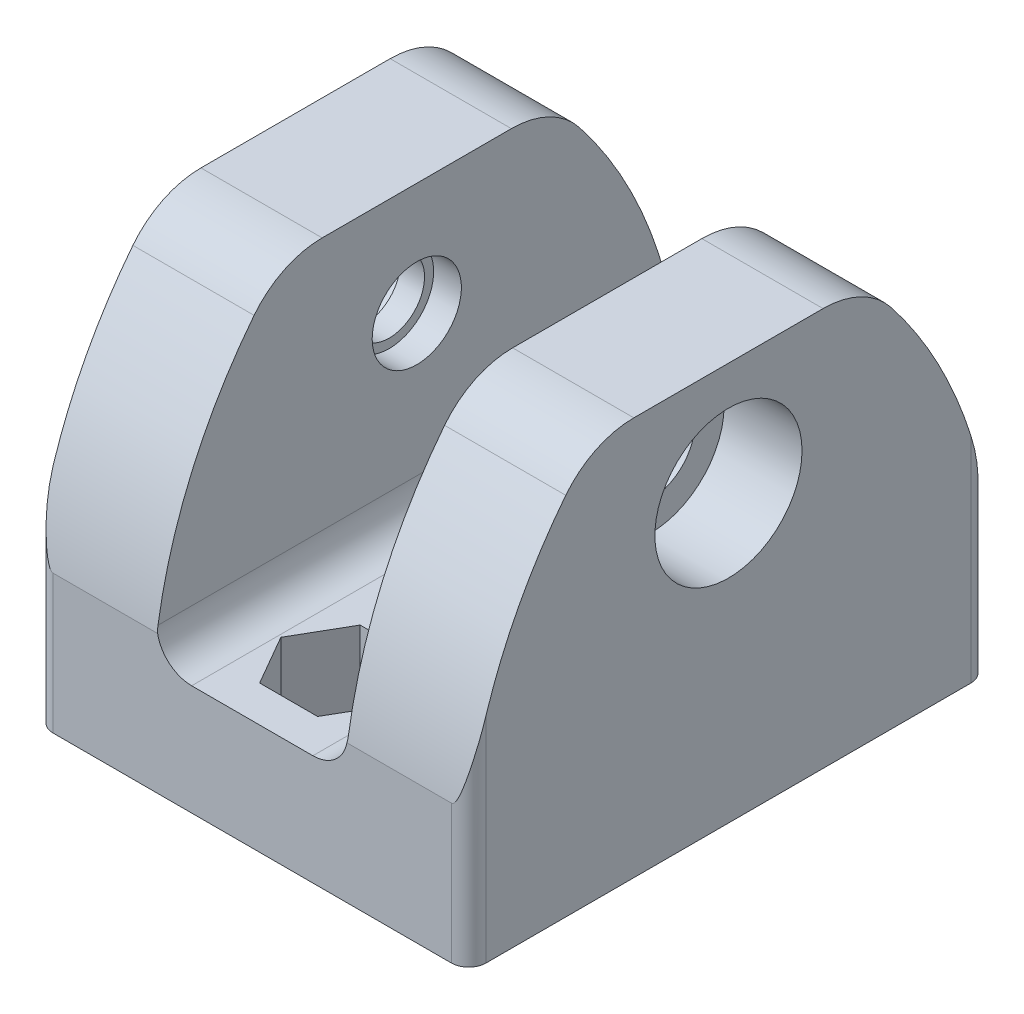
from build123d import *

# Parameters (mm, degrees)
CROQUIS1_W              = 25
CROQUIS1_H              = 30
CROQUIS1_R              = 1.55
SALIENTE_EXTRUIR1_DEPTH = 23
CORTAR_EXTRUIR1_REACH   = 47.321
CROQUIS2_W              = 9
CROQUIS2_H              = 16.632666969
CORTAR_EXTRUIR2_REACH   = 47.321
CROQUIS3_R              = 2.575
CORTAR_EXTRUIR3_DEPTH   = 2.5
CROQUIS5_R              = 4.25
CORTAR_EXTRUIR4_DEPTH   = 4.5
CORTAR_EXTRUIR5_DEPTH   = 4.5
CORTAR_EXTRUIR6_REACH   = 47.321
REDONDEO3_R             = 1
CROQUIS8_R              = 2.575
CROQUIS8_R_2            = 2.05
SALIENTE_EXTRUIR2_DEPTH = 2.9
CORTAR_EXTRUIR7_DEPTH   = 1.5
CORTAR_EXTRUIR8_START   = -16.632667
CROQUIS10_W             = 1
CROQUIS10_H             = 30
CORTAR_EXTRUIR8_DEPTH   = 16.632667
REDONDEO4_R             = 5
REDONDEO5_R             = 2


with BuildPart() as part:
    # Croquis1 → Saliente-Extruir1 (new body)
    with BuildSketch(Plane(origin=(0, 0, 0), x_dir=(1, 0, 0), z_dir=(0, 1, 0))):
        with Locations((12.5, 15)):
            Rectangle(CROQUIS1_W, CROQUIS1_H)
        with Locations(Location((12.5, 25, 0), (0, 0, 270))):
            Circle(CROQUIS1_R, mode=Mode.SUBTRACT)
        with Locations(Location((12.5, 5, 0), (0, 0, 270))):
            Circle(CROQUIS1_R, mode=Mode.SUBTRACT)
    extrude(amount=SALIENTE_EXTRUIR1_DEPTH)

    # Cortar-Extruir1: up to this face of the body (flat: up to its plane)
    cortar_extruir1_end = Plane(part.part.faces().sort_by_distance((12.5, 11.5, 0))[0])
    # Croquis2 → Cortar-Extruir1 (cut, up to the picked face)
    with BuildSketch(Plane(origin=(0, 0, -30), x_dir=(-1, 0, 0), z_dir=(0, 0, -1)), mode=Mode.PRIVATE) as cortar_extruir1_sk1:
        with Locations((-12.5, 14.683666516)):
            Rectangle(CROQUIS2_W, CROQUIS2_H)
    cortar_extruir1_tool1 = split(extrude(cortar_extruir1_sk1.sketch, amount=-CORTAR_EXTRUIR1_REACH, mode=Mode.PRIVATE), bisect_by=cortar_extruir1_end, keep=Keep.BOTH, mode=Mode.PRIVATE)
    add(cortar_extruir1_tool1.solids().sort_by(Axis((12.5, 14.683667, -30), (0, 0, 1)))[0], mode=Mode.SUBTRACT)

    # Cortar-Extruir2: up to this face of the body (flat: up to its plane)
    cortar_extruir2_end = Plane(part.part.faces().sort_by_distance((25, 11.5, -15))[0])
    # Croquis3 → Cortar-Extruir2 (cut, up to the picked face)
    with BuildSketch(Plane.ZY, mode=Mode.PRIVATE) as cortar_extruir2_sk1:
        with Locations((-15, 16.5)):
            Circle(CROQUIS3_R)
    cortar_extruir2_tool1 = split(extrude(cortar_extruir2_sk1.sketch, amount=-CORTAR_EXTRUIR2_REACH, mode=Mode.PRIVATE), bisect_by=cortar_extruir2_end, keep=Keep.BOTH, mode=Mode.PRIVATE)
    add(cortar_extruir2_tool1.solids().sort_by(Axis((0, 16.5, -15), (1, 0, 0)))[0], mode=Mode.SUBTRACT)

    # Croquis4 → Cortar-Extruir3 (cut)
    with BuildSketch(Plane.ZY):
        Polygon((-14.95180736, 20.541164535), (-18.475654829, 18.562318318), (-18.523847469, 14.521153783), (-15.04819264, 12.458835465), (-11.524345171, 14.437681682), (-11.476152531, 18.478846217), align=None)
    extrude(amount=-CORTAR_EXTRUIR3_DEPTH, mode=Mode.SUBTRACT)

    # Croquis5 → Cortar-Extruir4 (cut)
    with BuildSketch(Plane(origin=(25, 0, 0), x_dir=(0, 0, -1), z_dir=(1, 0, 0))):
        with Locations((15, 16.5)):
            Circle(CROQUIS5_R)
    extrude(amount=-CORTAR_EXTRUIR4_DEPTH, mode=Mode.SUBTRACT)

    # Croquis6 → Cortar-Extruir5 (cut)
    with BuildSketch(Plane(origin=(0, 6.367333031, 0), x_dir=(1, 0, 0), z_dir=(0, 1, 0))):
        Polygon((15.848631561, 25), (14.174315781, 27.9), (10.825684219, 27.9), (9.151368439, 25), (10.825684219, 22.1), (14.174315781, 22.1), align=None)
        Polygon((15.848631561, 5), (14.174315781, 7.9), (10.825684219, 7.9), (9.151368439, 5), (10.825684219, 2.1), (14.174315781, 2.1), align=None)
    extrude(amount=-CORTAR_EXTRUIR5_DEPTH, mode=Mode.SUBTRACT)

    # Cortar-Extruir6: up to this face of the body (flat: up to its plane)
    cortar_extruir6_end = Plane(part.part.faces().sort_by_distance((25, 11.051957593, -15))[0])
    # Croquis7 → Cortar-Extruir6 (cut, up to the picked face)
    with BuildSketch(Plane.ZY, mode=Mode.PRIVATE) as cortar_extruir6_sk1:
        with BuildLine():
            Line((-22.745966692, 23), (-30, 23))
            Line((-30, 23), (-30, 8))
            ThreePointArc((-30, 8), (-27.536048339, 16.062460813), (-22.745966692, 23))
        make_face()
    cortar_extruir6_tool1 = split(extrude(cortar_extruir6_sk1.sketch, amount=-CORTAR_EXTRUIR6_REACH, mode=Mode.PRIVATE), bisect_by=cortar_extruir6_end, keep=Keep.BOTH, mode=Mode.PRIVATE)
    # Croquis7 → Cortar-Extruir6 (cut, up to the picked face)
    with BuildSketch(Plane.ZY, mode=Mode.PRIVATE) as cortar_extruir6_sk2:
        with BuildLine():
            Line((0, 23), (-7.254033308, 23))
            ThreePointArc((-7.254033308, 23), (-2.463951661, 16.062460813), (0, 8))
            Line((0, 8), (0, 23))
        make_face()
    cortar_extruir6_tool2 = split(extrude(cortar_extruir6_sk2.sketch, amount=-CORTAR_EXTRUIR6_REACH, mode=Mode.PRIVATE), bisect_by=cortar_extruir6_end, keep=Keep.BOTH, mode=Mode.PRIVATE)
    add(cortar_extruir6_tool1.solids().sort_by(Axis((0, 18.820242, -27.849866), (1, 0, 0)))[0], mode=Mode.SUBTRACT)
    add(cortar_extruir6_tool2.solids().sort_by(Axis((0, 18.820242, -2.150134), (1, 0, 0)))[0], mode=Mode.SUBTRACT)

    # Redondeo3
    redondeo3_edges = [part.edges().sort_by_distance(p)[0] for p in [
        (25, 4, -30),
        (0, 4, -30),
        (25, 4, 0),
        (0, 4, 0),
    ]]
    fillet(redondeo3_edges, radius=REDONDEO3_R)

    # Croquis8 → Saliente-Extruir2 (add)
    with BuildSketch(Plane.ZY.offset(-2.5)):
        with Locations((-15, 16.5)):
            Circle(CROQUIS8_R)
        with Locations((-15, 16.5)):
            Circle(CROQUIS8_R_2, mode=Mode.SUBTRACT)
    extrude(amount=-SALIENTE_EXTRUIR2_DEPTH)

    # Croquis9 → Cortar-Extruir7 (cut)
    with BuildSketch(Plane.ZY.offset(-2.5)):
        Polygon((-11.476152531, 18.478846217), (-14.95180736, 20.541164535), (-18.475654829, 18.562318318), (-18.523847469, 14.521153783), (-15.04819264, 12.458835465), (-11.524345171, 14.437681682), align=None)
    extrude(amount=-CORTAR_EXTRUIR7_DEPTH, mode=Mode.SUBTRACT)

    # Croquis10 → Cortar-Extruir8 (cut)
    with BuildSketch(Plane(origin=(0, 23, 0), x_dir=(1, 0, 0), z_dir=(0, 1, 0)).offset(CORTAR_EXTRUIR8_START)):
        with Locations((17.5, 15)):
            Rectangle(CROQUIS10_W, CROQUIS10_H)
        with Locations((7.5, 15)):
            Rectangle(CROQUIS10_W, CROQUIS10_H)
    extrude(amount=CORTAR_EXTRUIR8_DEPTH, mode=Mode.SUBTRACT)

    # Redondeo4
    redondeo4_edges = [part.edges().sort_by_distance(p)[0] for p in [
        (21.5, 23, -22.745966692),
        (21.5, 23, -7.254033308),
        (3.5, 23, -22.745966692),
        (3.5, 23, -7.254033308),
    ]]
    fillet(redondeo4_edges, radius=REDONDEO4_R)

    # Redondeo5
    # the kernel refuses this fillet: 2 mm, written as the material it adds along each edge
    with BuildSketch(Plane(origin=(7, 6.367333, 0), x_dir=(1, 0, 0), z_dir=(0, 0, -1))) as redondeo5_piece_1_section:
        with BuildLine():
            CenterArc((REDONDEO5_R, -REDONDEO5_R), REDONDEO5_R, 90, 90)
            Line((0, -REDONDEO5_R), (0, 0))
            Line((0, 0), (REDONDEO5_R, 0))
        make_face()
    redondeo5_piece_1 = extrude(amount=30, mode=Mode.PRIVATE)
    redondeo5_piece_1 = redondeo5_piece_1 & Plane(origin=(7.452804223, 4.086860333, -2.772720189), x_dir=(0, 0.14225955268543314, -0.9898293891725687), z_dir=(-1, 0, 0)) * Cylinder(27.507043243, 68, mode=Mode.PRIVATE)
    redondeo5_piece_1 = redondeo5_piece_1 & Plane(origin=(7.452804223, 4.086860333, -27.227279811), x_dir=(0, 0.6875744332215433, 0.7261139020705178), z_dir=(-1, 0, 0)) * Cylinder(27.507043243, 68, mode=Mode.PRIVATE)
    add(redondeo5_piece_1)
    with BuildSketch(Plane(origin=(18, 6.367333, 0), x_dir=(0, 1, 0), z_dir=(0, 0, -1))) as redondeo5_piece_2_section:
        with BuildLine():
            CenterArc((REDONDEO5_R, -REDONDEO5_R), REDONDEO5_R, 90, 90)
            Line((0, -REDONDEO5_R), (0, 0))
            Line((0, 0), (REDONDEO5_R, 0))
        make_face()
    redondeo5_piece_2 = extrude(amount=30, mode=Mode.PRIVATE)
    redondeo5_piece_2 = redondeo5_piece_2 & Plane(origin=(17.547195777, 4.086860333, -27.227279811), x_dir=(0, 0.6875744332215433, 0.7261139020705178), z_dir=(-1, 0, 0)) * Cylinder(27.507043243, 69, mode=Mode.PRIVATE)
    redondeo5_piece_2 = redondeo5_piece_2 & Plane(origin=(17.547195777, 4.086860333, -2.772720189), x_dir=(0, 0.14225955268543314, -0.9898293891725687), z_dir=(-1, 0, 0)) * Cylinder(27.507043243, 69, mode=Mode.PRIVATE)
    add(redondeo5_piece_2)


solid = part.part
